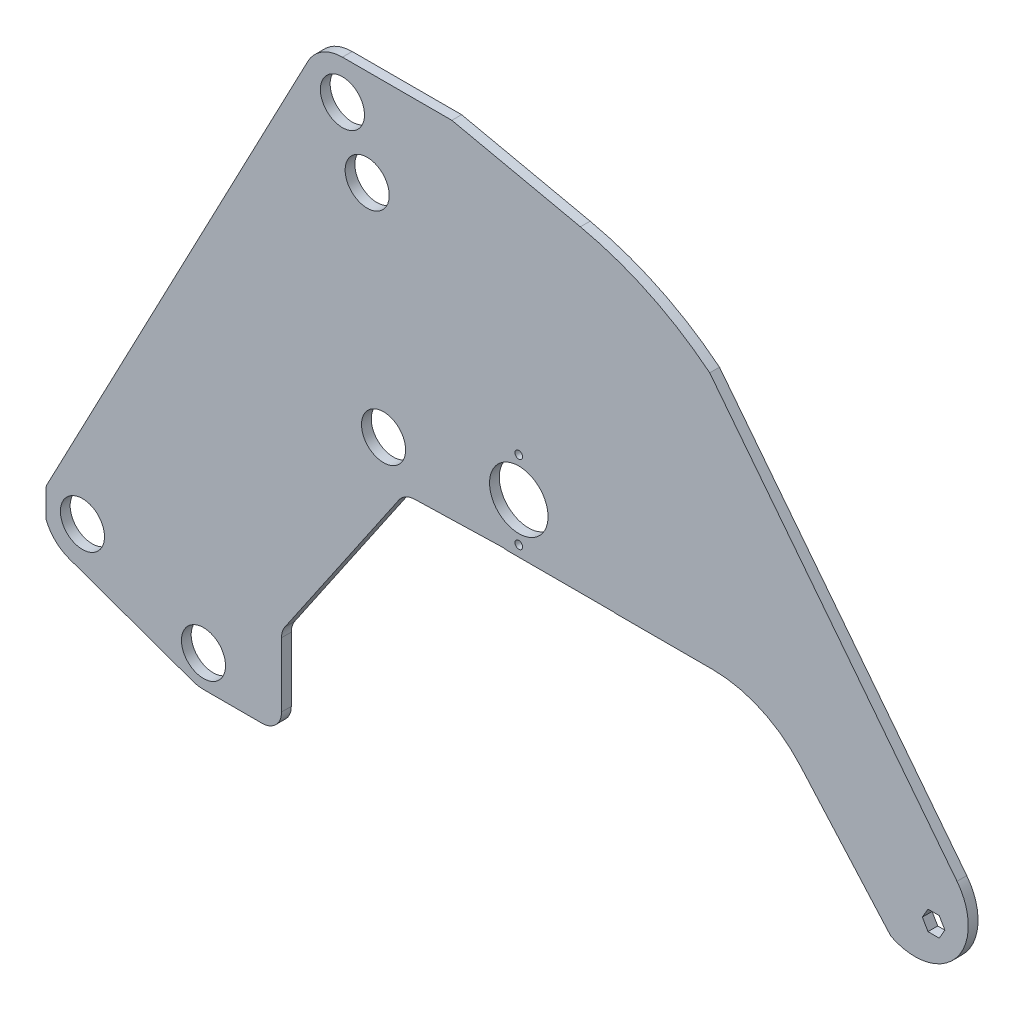
from build123d import *

# Parameters (mm, degrees)
MODEL_R             = 14.351
MODEL_R_2           = 2.4892
MODEL_R_3           = 19.05
BOSS_EXTRUDE1_DEPTH = 6.35
CUT_EXTRUDE1_START  = -6.35
SKETCH2_R           = 2.4892
CUT_EXTRUDE1_DEPTH  = 6.35
BOSS_EXTRUDE2_DEPTH = 6.35
FILLET1_R           = 76.2
CUT_EXTRUDE2_DEPTH  = 6.35


with BuildPart() as part:
    # Model → Boss-Extrude1 (new body)
    with BuildSketch(Plane.XY):
        with BuildLine():
            ThreePointArc((58.6680564, -22.225), (67.648312521, -18.505256121), (71.3680564, -9.525))
            Line((71.3680564, -9.525), (71.3680564, 43.162005366))
            ThreePointArc((71.3680564, 43.162005366), (70.286480643, 48.290574182), (67.225974809, 52.545609817))
            Line((67.225974809, 52.545609817), (-231.724912696, 325.191085975))
            ThreePointArc((-231.724912696, 325.191085975), (-253.238197861, 331.440320626), (-271.33067791, 318.229092902))
            Line((-271.33067791, 318.229092902), (-440.555640395, -4.158684171))
            ThreePointArc((-440.555640395, -4.158684171), (-441.212773023, -5.505718227), (-441.789312, -6.889165677))
            Line((-441.789312, -6.889165677), (-441.789312, -25.038634323))
            ThreePointArc((-441.789312, -25.038634323), (-435.829532347, -34.118973304), (-426.62152736, -39.879543908))
            Line((-426.62152736, -39.879543908), (-346.203265936, -68.649155922))
            ThreePointArc((-346.203265936, -68.649155922), (-342.794136372, -69.547563331), (-339.28161131, -69.85))
            Line((-339.28161131, -69.85), (-301.18161131, -69.85))
            ThreePointArc((-301.18161131, -69.85), (-292.201355189, -66.130256121), (-288.48161131, -57.15))
            Line((-288.48161131, -57.15), (-288.48161131, -15.263054603))
            ThreePointArc((-288.48161131, -15.263054603), (-287.916123528, -11.515573687), (-286.270018677, -8.101817916))
            Line((-286.270018677, -8.101817916), (-212.077490922, 100.561181044))
            ThreePointArc((-212.077490922, 100.561181044), (-207.671459082, 104.548698007), (-201.933730241, 106.095267065))
            Line((-201.933730241, 106.095267065), (-145.278114328, 107.633327242))
            ThreePointArc((-145.278114328, 107.633327242), (-141.931465661, 107.278101134), (-138.795626118, 106.056318319))
            Line((-138.795626118, 106.056318319), (-87.594102076, 77.790625657))
            ThreePointArc((-87.594102076, 77.790625657), (-82.794837325, 73.127519562), (-81.0319436, 66.672311872))
            Line((-81.0319436, 66.672311872), (-81.0319436, -9.525))
            ThreePointArc((-81.0319436, -9.525), (-77.312199721, -18.505256121), (-68.3319436, -22.225))
            Line((-68.3319436, -22.225), (58.6680564, -22.225))
        make_face()
        with Locations((-339.28161131, -49.3014)):
            Circle(MODEL_R, mode=Mode.SUBTRACT)
        with Locations((-418.065712, -15.9639)):
            Circle(MODEL_R, mode=Mode.SUBTRACT)
        with Locations((-222.079312, 130.957722259)):
            Circle(MODEL_R, mode=Mode.SUBTRACT)
        with Locations((-68.3319436, -14.732)):
            Circle(MODEL_R_2, mode=Mode.SUBTRACT)
        with Locations((58.6680564, -14.732)):
            Circle(MODEL_R_2, mode=Mode.SUBTRACT)
        with Locations((-68.3319436, 42.418)):
            Circle(MODEL_R_2, mode=Mode.SUBTRACT)
        with Locations((-134.044120223, 114.3)):
            Circle(MODEL_R_2, mode=Mode.SUBTRACT)
        with Locations((58.6680564, 42.418)):
            Circle(MODEL_R_2, mode=Mode.SUBTRACT)
        with Locations((-232.729624751, 269.086142594)):
            Circle(MODEL_R, mode=Mode.SUBTRACT)
        with Locations((-248.840749515, 306.423877073)):
            Circle(MODEL_R, mode=Mode.SUBTRACT)
        with Locations((-134.044120223, 139.7)):
            Circle(MODEL_R_3, mode=Mode.SUBTRACT)
        with Locations((-134.044120223, 165.1)):
            Circle(MODEL_R_2, mode=Mode.SUBTRACT)
    extrude(amount=BOSS_EXTRUDE1_DEPTH)

    # Sketch2 → Cut-Extrude1 (cut)
    with BuildSketch(Plane.XY.offset(6.35).offset(CUT_EXTRUDE1_START)):
        with BuildLine():
            Line((71.3680564, 43.162005366), (71.3680564, 107.139723404))
            Line((71.3680564, 107.139723404), (-71.738472541, 107.139723404))
            Line((-71.738472541, 107.139723404), (-71.930423723, 107.3368586))
            Line((-71.930423723, 107.3368586), (-142.184209952, 107.3368586))
            ThreePointArc((-142.184209952, 107.3368586), (-140.444026812, 106.818026463), (-138.795626118, 106.056318319))
            Line((-138.795626118, 106.056318319), (-87.594102076, 77.790625657))
            ThreePointArc((-87.594102076, 77.790625657), (-82.794837325, 73.127519562), (-81.0319436, 66.672311872))
            Line((-81.0319436, 66.672311872), (-81.0319436, 31.351218728))
            Line((-81.0319436, 31.351218728), (-81.0319436, -9.525))
            ThreePointArc((-81.0319436, -9.525), (-77.312199721, -18.505256121), (-68.3319436, -22.225))
            Line((-68.3319436, -22.225), (58.6680564, -22.225))
            ThreePointArc((58.6680564, -22.225), (67.648312521, -18.505256121), (71.3680564, -9.525))
            Line((71.3680564, -9.525), (71.3680564, 43.162005366))
        make_face()
        with Locations((-68.3319436, -14.732)):
            Circle(SKETCH2_R, mode=Mode.SUBTRACT)
        with Locations((58.6680564, -14.732)):
            Circle(SKETCH2_R, mode=Mode.SUBTRACT)
        with Locations((-68.3319436, 42.418)):
            Circle(SKETCH2_R, mode=Mode.SUBTRACT)
    extrude(amount=CUT_EXTRUDE1_DEPTH, mode=Mode.SUBTRACT)

    # Sketch3 → Boss-Extrude2 (add)
    with BuildSketch(Plane.XY.offset(6.35)):
        with BuildLine():
            Line((-93.952241598, 313.634244328), (-177.629609361, 331.823877073))
            Line((-177.629609361, 331.823877073), (-248.840749515, 331.823877073))
            Line((-248.840749515, 331.823877073), (7.364505845, 107.139723404))
            Line((7.364505845, 107.139723404), (26.357264716, 107.139723404))
            Line((26.357264716, 107.139723404), (28.89543614, 104.34401951))
            Line((28.89543614, 104.34401951), (108.084176226, 14.836159574))
            ThreePointArc((108.084176226, 14.836159574), (150.634753827, 23.794870802), (151.177492425, 67.274930553))
            Line((151.177492425, 67.274930553), (-9.789013471, 273.432500872))
            ThreePointArc((-9.789013471, 273.432500872), (-49.53277602, 298.427715814), (-93.952241598, 313.634244328))
        make_face()
    extrude(amount=-BOSS_EXTRUDE2_DEPTH)

    # Fillet1
    fillet1_edges = [part.edges().sort_by_distance(p)[0] for p in [
        (26.357264716, 107.139723404, 3.175),
    ]]
    fillet(fillet1_edges, radius=FILLET1_R)

    # Sketch4 → Cut-Extrude2 (cut)
    with BuildSketch(Plane.XY.offset(6.35)):
        Polygon((143.292158205, 35.791499604), (139.625983996, 42.141499604), (132.293635577, 42.141499604), (128.627461367, 35.791499604), (132.293635577, 29.441499604), (139.625983996, 29.441499604), align=None)
    extrude(amount=-CUT_EXTRUDE2_DEPTH, mode=Mode.SUBTRACT)


solid = part.part
